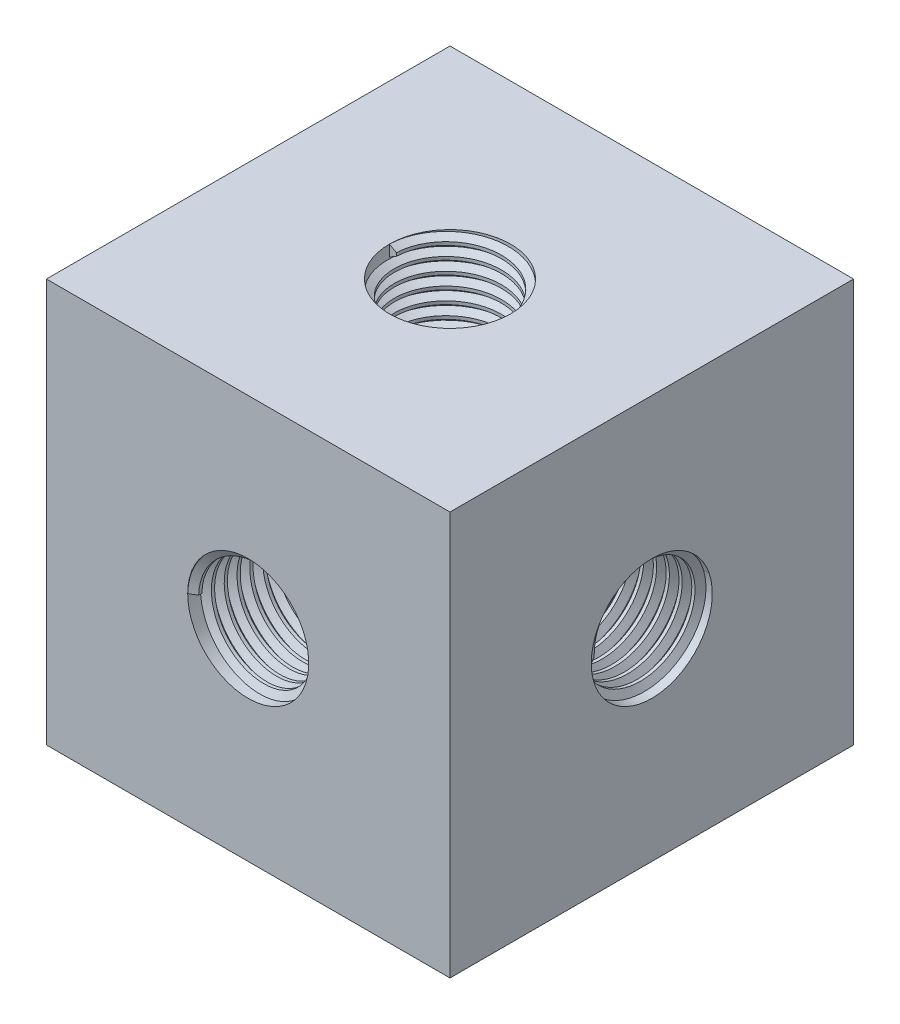
from build123d import *
from build123d.topology import SkipClean

# Parameters (mm, degrees)
SKETCH_1_W          = 10
SKETCH_1_H          = 10
SKETCH_1_R          = 1.5
EXTRUDE_1_DEPTH     = 10
SKETCH_2_R          = 1.5
CUT_EXTRUDE_1_DEPTH = 10
SKETCH_3_R          = 1.5
CUT_EXTRUDE_2_DEPTH = 10
THREAD_1_PITCH      = 0.3175
THREAD_2_PITCH      = 0.3175
THREAD_3_PITCH      = 0.3175
THREAD_4_PITCH      = 0.3175
THREAD_5_PITCH      = 0.3175
THREAD_6_PITCH      = 0.3175


with BuildPart() as part:
    # Sketch 1 → 凸台-拉伸1 (new body)
    with BuildSketch(Plane.XY):
        with Locations((5, -5)):
            Rectangle(SKETCH_1_W, SKETCH_1_H)
        with Locations((5, -5)):
            Circle(SKETCH_1_R, mode=Mode.SUBTRACT)
    extrude(amount=EXTRUDE_1_DEPTH)

    # Sketch 2 → 切除-拉伸1 (cut)
    with BuildSketch(Plane(origin=(10, 0, 0), x_dir=(0, 0, -1), z_dir=(1, 0, 0))):
        with Locations((-5, -5)):
            Circle(SKETCH_2_R)
    extrude(amount=-CUT_EXTRUDE_1_DEPTH, mode=Mode.SUBTRACT)

    # Sketch 3 → 切除-拉伸2 (cut)
    with BuildSketch(Plane(origin=(0, 0, 0), x_dir=(1, 0, 0), z_dir=(0, 1, 0))):
        with Locations(Location((5, -5, 0), (0, 0, 270))):
            Circle(SKETCH_3_R)
    extrude(amount=-CUT_EXTRUDE_2_DEPTH, mode=Mode.SUBTRACT)

    # 螺纹线1: the profile of Sketch 1 2 profile screwed along a right-hand helix of 9.448819 turns, 6 arcs to a turn; built about Z, then put on its axis
    with SkipClean():  # the faces are left unmerged after this step: merging them gives an invalid solid
        thread_1_z = Axis((0, 0, 0), (0, 0, 1))
        thread_1_corners = [(1.5003, 0, -0.000173205), (1.5003, 0, 0.277985704), (1.328148085, 0, 0.17859375), (1.328148085, 0, 0.09921875)]
        with BuildLine(mode=Mode.PRIVATE) as thread_1_profile:
            Line(thread_1_corners[0], thread_1_corners[1])
            Line(thread_1_corners[1], thread_1_corners[2])
            Line(thread_1_corners[2], thread_1_corners[3])
            Line(thread_1_corners[3], thread_1_corners[0])
        thread_1_cap = Face(thread_1_profile.wire())
        thread_1_turn_angles = [0, 30, 60, 90, 120, 150, 180, 210, 240, 270, 300, 330, 360]
        thread_1_turn_weights = [1, 0.8660254037844387, 1, 0.8660254037844387, 1, 0.8660254037844387, 1, 0.8660254037844387, 1, 0.8660254037844387, 1, 0.8660254037844387, 1]
        thread_1_turn_rails = [Edge.make_bspline([Vector(p[0], p[1], 0).rotate(thread_1_z, thread_1_turn_angles[k]) / thread_1_turn_weights[k] + Vector(0, 0, p[2] + THREAD_1_PITCH * thread_1_turn_angles[k] / 360) for k in range(13)], [0, 0, 0, 1, 1, 2, 2, 3, 3, 4, 4, 5, 5, 6, 6, 6], 2, thread_1_turn_weights) for p in thread_1_corners]
        thread_1_turn_sides = [Face.make_surface_from_curves(thread_1_turn_rails[p[0]], thread_1_turn_rails[p[1]]) for p in [(0, 1), (1, 2), (2, 3), (3, 0)]]
        thread_1_last_angles = [3240, 3270, 3300, 3330, 3360, 3380.787401575, 3401.57480315]
        thread_1_last_weights = [1, 0.8660254037844387, 1, 0.8660254037844387, 1, 0.9349037361358654, 1]
        thread_1_last_rails = [Edge.make_bspline([Vector(p[0], p[1], 0).rotate(thread_1_z, thread_1_last_angles[k]) / thread_1_last_weights[k] + Vector(0, 0, p[2] + THREAD_1_PITCH * thread_1_last_angles[k] / 360) for k in range(7)], [0, 0, 0, 1, 1, 2, 2, 3, 3, 3], 2, thread_1_last_weights) for p in thread_1_corners]
        thread_1_last_sides = [Face.make_surface_from_curves(thread_1_last_rails[p[0]], thread_1_last_rails[p[1]]) for p in [(0, 1), (1, 2), (2, 3), (3, 0)]]
        thread_1 = Plane(origin=(5, 0, 5), x_dir=(-1, 0, 0), z_dir=(0, -1, 0)) * Solid(Shell([*[p.moved(Location((0, 0, THREAD_1_PITCH * i))) for i in range(9) for p in thread_1_turn_sides], *thread_1_last_sides, thread_1_cap, thread_1_cap.rotate(thread_1_z, 3401.57480315).moved(Location((0, 0, THREAD_1_PITCH * 3401.57480315 / 360)))]))
        add(thread_1)

    # 螺纹线2: the profile of Sketch 2 2 profile screwed along a right-hand helix of 9.448819 turns, 6 arcs to a turn; built about Z, then put on its axis
    with SkipClean():  # the faces are left unmerged after this step: merging them gives an invalid solid
        thread_2_z = Axis((0, 0, 0), (0, 0, 1))
        thread_2_corners = [(1.5003, 0, -0.000173205), (1.5003, 0, 0.277985704), (1.328148085, 0, 0.17859375), (1.328148085, 0, 0.09921875)]
        with BuildLine(mode=Mode.PRIVATE) as thread_2_profile:
            Line(thread_2_corners[0], thread_2_corners[1])
            Line(thread_2_corners[1], thread_2_corners[2])
            Line(thread_2_corners[2], thread_2_corners[3])
            Line(thread_2_corners[3], thread_2_corners[0])
        thread_2_cap = Face(thread_2_profile.wire())
        thread_2_turn_angles = [0, 30, 60, 90, 120, 150, 180, 210, 240, 270, 300, 330, 360]
        thread_2_turn_weights = [1, 0.8660254037844387, 1, 0.8660254037844387, 1, 0.8660254037844387, 1, 0.8660254037844387, 1, 0.8660254037844387, 1, 0.8660254037844387, 1]
        thread_2_turn_rails = [Edge.make_bspline([Vector(p[0], p[1], 0).rotate(thread_2_z, thread_2_turn_angles[k]) / thread_2_turn_weights[k] + Vector(0, 0, p[2] + THREAD_2_PITCH * thread_2_turn_angles[k] / 360) for k in range(13)], [0, 0, 0, 1, 1, 2, 2, 3, 3, 4, 4, 5, 5, 6, 6, 6], 2, thread_2_turn_weights) for p in thread_2_corners]
        thread_2_turn_sides = [Face.make_surface_from_curves(thread_2_turn_rails[p[0]], thread_2_turn_rails[p[1]]) for p in [(0, 1), (1, 2), (2, 3), (3, 0)]]
        thread_2_last_angles = [3240, 3270, 3300, 3330, 3360, 3380.787401575, 3401.57480315]
        thread_2_last_weights = [1, 0.8660254037844387, 1, 0.8660254037844387, 1, 0.9349037361358654, 1]
        thread_2_last_rails = [Edge.make_bspline([Vector(p[0], p[1], 0).rotate(thread_2_z, thread_2_last_angles[k]) / thread_2_last_weights[k] + Vector(0, 0, p[2] + THREAD_2_PITCH * thread_2_last_angles[k] / 360) for k in range(7)], [0, 0, 0, 1, 1, 2, 2, 3, 3, 3], 2, thread_2_last_weights) for p in thread_2_corners]
        thread_2_last_sides = [Face.make_surface_from_curves(thread_2_last_rails[p[0]], thread_2_last_rails[p[1]]) for p in [(0, 1), (1, 2), (2, 3), (3, 0)]]
        thread_2 = Plane(origin=(5, -5, 0), x_dir=(1, 0, 0), z_dir=(0, 0, 1)) * Solid(Shell([*[p.moved(Location((0, 0, THREAD_2_PITCH * i))) for i in range(9) for p in thread_2_turn_sides], *thread_2_last_sides, thread_2_cap, thread_2_cap.rotate(thread_2_z, 3401.57480315).moved(Location((0, 0, THREAD_2_PITCH * 3401.57480315 / 360)))]))
        add(thread_2)

    # 螺纹线3: the profile of Sketch 3 2 profile screwed along a right-hand helix of 9.448819 turns, 6 arcs to a turn; built about Z, then put on its axis
    with SkipClean():  # the faces are left unmerged after this step: merging them gives an invalid solid
        thread_3_z = Axis((0, 0, 0), (0, 0, 1))
        thread_3_corners = [(1.5003, 0, -0.000173205), (1.5003, 0, 0.277985704), (1.328148085, 0, 0.17859375), (1.328148085, 0, 0.09921875)]
        with BuildLine(mode=Mode.PRIVATE) as thread_3_profile:
            Line(thread_3_corners[0], thread_3_corners[1])
            Line(thread_3_corners[1], thread_3_corners[2])
            Line(thread_3_corners[2], thread_3_corners[3])
            Line(thread_3_corners[3], thread_3_corners[0])
        thread_3_cap = Face(thread_3_profile.wire())
        thread_3_turn_angles = [0, 30, 60, 90, 120, 150, 180, 210, 240, 270, 300, 330, 360]
        thread_3_turn_weights = [1, 0.8660254037844387, 1, 0.8660254037844387, 1, 0.8660254037844387, 1, 0.8660254037844387, 1, 0.8660254037844387, 1, 0.8660254037844387, 1]
        thread_3_turn_rails = [Edge.make_bspline([Vector(p[0], p[1], 0).rotate(thread_3_z, thread_3_turn_angles[k]) / thread_3_turn_weights[k] + Vector(0, 0, p[2] + THREAD_3_PITCH * thread_3_turn_angles[k] / 360) for k in range(13)], [0, 0, 0, 1, 1, 2, 2, 3, 3, 4, 4, 5, 5, 6, 6, 6], 2, thread_3_turn_weights) for p in thread_3_corners]
        thread_3_turn_sides = [Face.make_surface_from_curves(thread_3_turn_rails[p[0]], thread_3_turn_rails[p[1]]) for p in [(0, 1), (1, 2), (2, 3), (3, 0)]]
        thread_3_last_angles = [3240, 3270, 3300, 3330, 3360, 3380.787401575, 3401.57480315]
        thread_3_last_weights = [1, 0.8660254037844387, 1, 0.8660254037844387, 1, 0.9349037361358654, 1]
        thread_3_last_rails = [Edge.make_bspline([Vector(p[0], p[1], 0).rotate(thread_3_z, thread_3_last_angles[k]) / thread_3_last_weights[k] + Vector(0, 0, p[2] + THREAD_3_PITCH * thread_3_last_angles[k] / 360) for k in range(7)], [0, 0, 0, 1, 1, 2, 2, 3, 3, 3], 2, thread_3_last_weights) for p in thread_3_corners]
        thread_3_last_sides = [Face.make_surface_from_curves(thread_3_last_rails[p[0]], thread_3_last_rails[p[1]]) for p in [(0, 1), (1, 2), (2, 3), (3, 0)]]
        thread_3 = Plane(origin=(5, -10, 5), x_dir=(1, 0, 0), z_dir=(0, 1, 0)) * Solid(Shell([*[p.moved(Location((0, 0, THREAD_3_PITCH * i))) for i in range(9) for p in thread_3_turn_sides], *thread_3_last_sides, thread_3_cap, thread_3_cap.rotate(thread_3_z, 3401.57480315).moved(Location((0, 0, THREAD_3_PITCH * 3401.57480315 / 360)))]))
        add(thread_3)

    # 螺纹线4: the profile of 螺纹线轮廓4 profile screwed along a right-hand helix of 9.448819 turns, 6 arcs to a turn; built about Z, then put on its axis
    with SkipClean():  # the faces are left unmerged after this step: merging them gives an invalid solid
        thread_4_z = Axis((0, 0, 0), (0, 0, 1))
        thread_4_corners = [(1.5003, 0, -0.000173205), (1.5003, 0, 0.277985704), (1.328148085, 0, 0.17859375), (1.328148085, 0, 0.09921875)]
        with BuildLine(mode=Mode.PRIVATE) as thread_4_profile:
            Line(thread_4_corners[0], thread_4_corners[1])
            Line(thread_4_corners[1], thread_4_corners[2])
            Line(thread_4_corners[2], thread_4_corners[3])
            Line(thread_4_corners[3], thread_4_corners[0])
        thread_4_cap = Face(thread_4_profile.wire())
        thread_4_turn_angles = [0, 30, 60, 90, 120, 150, 180, 210, 240, 270, 300, 330, 360]
        thread_4_turn_weights = [1, 0.8660254037844387, 1, 0.8660254037844387, 1, 0.8660254037844387, 1, 0.8660254037844387, 1, 0.8660254037844387, 1, 0.8660254037844387, 1]
        thread_4_turn_rails = [Edge.make_bspline([Vector(p[0], p[1], 0).rotate(thread_4_z, thread_4_turn_angles[k]) / thread_4_turn_weights[k] + Vector(0, 0, p[2] + THREAD_4_PITCH * thread_4_turn_angles[k] / 360) for k in range(13)], [0, 0, 0, 1, 1, 2, 2, 3, 3, 4, 4, 5, 5, 6, 6, 6], 2, thread_4_turn_weights) for p in thread_4_corners]
        thread_4_turn_sides = [Face.make_surface_from_curves(thread_4_turn_rails[p[0]], thread_4_turn_rails[p[1]]) for p in [(0, 1), (1, 2), (2, 3), (3, 0)]]
        thread_4_last_angles = [3240, 3270, 3300, 3330, 3360, 3380.787401575, 3401.57480315]
        thread_4_last_weights = [1, 0.8660254037844387, 1, 0.8660254037844387, 1, 0.9349037361358654, 1]
        thread_4_last_rails = [Edge.make_bspline([Vector(p[0], p[1], 0).rotate(thread_4_z, thread_4_last_angles[k]) / thread_4_last_weights[k] + Vector(0, 0, p[2] + THREAD_4_PITCH * thread_4_last_angles[k] / 360) for k in range(7)], [0, 0, 0, 1, 1, 2, 2, 3, 3, 3], 2, thread_4_last_weights) for p in thread_4_corners]
        thread_4_last_sides = [Face.make_surface_from_curves(thread_4_last_rails[p[0]], thread_4_last_rails[p[1]]) for p in [(0, 1), (1, 2), (2, 3), (3, 0)]]
        thread_4 = Plane(origin=(10, -5, 5), x_dir=(0, 0, 1), z_dir=(-1, 0, 0)) * Solid(Shell([*[p.moved(Location((0, 0, THREAD_4_PITCH * i))) for i in range(9) for p in thread_4_turn_sides], *thread_4_last_sides, thread_4_cap, thread_4_cap.rotate(thread_4_z, 3401.57480315).moved(Location((0, 0, THREAD_4_PITCH * 3401.57480315 / 360)))]))
        add(thread_4)

    # 螺纹线5: the profile of 螺纹线轮廓5 profile screwed along a right-hand helix of 9.448819 turns, 6 arcs to a turn; built about Z, then put on its axis
    with SkipClean():  # the faces are left unmerged after this step: merging them gives an invalid solid
        thread_5_z = Axis((0, 0, 0), (0, 0, 1))
        thread_5_corners = [(1.5003, 0, -0.000173205), (1.5003, 0, 0.277985704), (1.328148085, 0, 0.17859375), (1.328148085, 0, 0.09921875)]
        with BuildLine(mode=Mode.PRIVATE) as thread_5_profile:
            Line(thread_5_corners[0], thread_5_corners[1])
            Line(thread_5_corners[1], thread_5_corners[2])
            Line(thread_5_corners[2], thread_5_corners[3])
            Line(thread_5_corners[3], thread_5_corners[0])
        thread_5_cap = Face(thread_5_profile.wire())
        thread_5_turn_angles = [0, 30, 60, 90, 120, 150, 180, 210, 240, 270, 300, 330, 360]
        thread_5_turn_weights = [1, 0.8660254037844387, 1, 0.8660254037844387, 1, 0.8660254037844387, 1, 0.8660254037844387, 1, 0.8660254037844387, 1, 0.8660254037844387, 1]
        thread_5_turn_rails = [Edge.make_bspline([Vector(p[0], p[1], 0).rotate(thread_5_z, thread_5_turn_angles[k]) / thread_5_turn_weights[k] + Vector(0, 0, p[2] + THREAD_5_PITCH * thread_5_turn_angles[k] / 360) for k in range(13)], [0, 0, 0, 1, 1, 2, 2, 3, 3, 4, 4, 5, 5, 6, 6, 6], 2, thread_5_turn_weights) for p in thread_5_corners]
        thread_5_turn_sides = [Face.make_surface_from_curves(thread_5_turn_rails[p[0]], thread_5_turn_rails[p[1]]) for p in [(0, 1), (1, 2), (2, 3), (3, 0)]]
        thread_5_last_angles = [3240, 3270, 3300, 3330, 3360, 3380.787401575, 3401.57480315]
        thread_5_last_weights = [1, 0.8660254037844387, 1, 0.8660254037844387, 1, 0.9349037361358654, 1]
        thread_5_last_rails = [Edge.make_bspline([Vector(p[0], p[1], 0).rotate(thread_5_z, thread_5_last_angles[k]) / thread_5_last_weights[k] + Vector(0, 0, p[2] + THREAD_5_PITCH * thread_5_last_angles[k] / 360) for k in range(7)], [0, 0, 0, 1, 1, 2, 2, 3, 3, 3], 2, thread_5_last_weights) for p in thread_5_corners]
        thread_5_last_sides = [Face.make_surface_from_curves(thread_5_last_rails[p[0]], thread_5_last_rails[p[1]]) for p in [(0, 1), (1, 2), (2, 3), (3, 0)]]
        thread_5 = Plane(origin=(0, -5, 5), x_dir=(0, 0, -1), z_dir=(1, 0, 0)) * Solid(Shell([*[p.moved(Location((0, 0, THREAD_5_PITCH * i))) for i in range(9) for p in thread_5_turn_sides], *thread_5_last_sides, thread_5_cap, thread_5_cap.rotate(thread_5_z, 3401.57480315).moved(Location((0, 0, THREAD_5_PITCH * 3401.57480315 / 360)))]))
        add(thread_5)

    # 螺纹线6: the profile of 螺纹线轮廓6 profile screwed along a right-hand helix of 9.448819 turns, 6 arcs to a turn; built about Z, then put on its axis
    with SkipClean():  # the faces are left unmerged after this step: merging them gives an invalid solid
        thread_6_z = Axis((0, 0, 0), (0, 0, 1))
        thread_6_corners = [(1.5003, 0, -0.000173205), (1.5003, 0, 0.277985704), (1.328148085, 0, 0.17859375), (1.328148085, 0, 0.09921875)]
        with BuildLine(mode=Mode.PRIVATE) as thread_6_profile:
            Line(thread_6_corners[0], thread_6_corners[1])
            Line(thread_6_corners[1], thread_6_corners[2])
            Line(thread_6_corners[2], thread_6_corners[3])
            Line(thread_6_corners[3], thread_6_corners[0])
        thread_6_cap = Face(thread_6_profile.wire())
        thread_6_turn_angles = [0, 30, 60, 90, 120, 150, 180, 210, 240, 270, 300, 330, 360]
        thread_6_turn_weights = [1, 0.8660254037844387, 1, 0.8660254037844387, 1, 0.8660254037844387, 1, 0.8660254037844387, 1, 0.8660254037844387, 1, 0.8660254037844387, 1]
        thread_6_turn_rails = [Edge.make_bspline([Vector(p[0], p[1], 0).rotate(thread_6_z, thread_6_turn_angles[k]) / thread_6_turn_weights[k] + Vector(0, 0, p[2] + THREAD_6_PITCH * thread_6_turn_angles[k] / 360) for k in range(13)], [0, 0, 0, 1, 1, 2, 2, 3, 3, 4, 4, 5, 5, 6, 6, 6], 2, thread_6_turn_weights) for p in thread_6_corners]
        thread_6_turn_sides = [Face.make_surface_from_curves(thread_6_turn_rails[p[0]], thread_6_turn_rails[p[1]]) for p in [(0, 1), (1, 2), (2, 3), (3, 0)]]
        thread_6_last_angles = [3240, 3270, 3300, 3330, 3360, 3380.787401575, 3401.57480315]
        thread_6_last_weights = [1, 0.8660254037844387, 1, 0.8660254037844387, 1, 0.9349037361358654, 1]
        thread_6_last_rails = [Edge.make_bspline([Vector(p[0], p[1], 0).rotate(thread_6_z, thread_6_last_angles[k]) / thread_6_last_weights[k] + Vector(0, 0, p[2] + THREAD_6_PITCH * thread_6_last_angles[k] / 360) for k in range(7)], [0, 0, 0, 1, 1, 2, 2, 3, 3, 3], 2, thread_6_last_weights) for p in thread_6_corners]
        thread_6_last_sides = [Face.make_surface_from_curves(thread_6_last_rails[p[0]], thread_6_last_rails[p[1]]) for p in [(0, 1), (1, 2), (2, 3), (3, 0)]]
        thread_6 = Plane(origin=(5, -5, 10), x_dir=(-1, 0, 0), z_dir=(0, 0, -1)) * Solid(Shell([*[p.moved(Location((0, 0, THREAD_6_PITCH * i))) for i in range(9) for p in thread_6_turn_sides], *thread_6_last_sides, thread_6_cap, thread_6_cap.rotate(thread_6_z, 3401.57480315).moved(Location((0, 0, THREAD_6_PITCH * 3401.57480315 / 360)))]))
        add(thread_6)


solid = part.part
